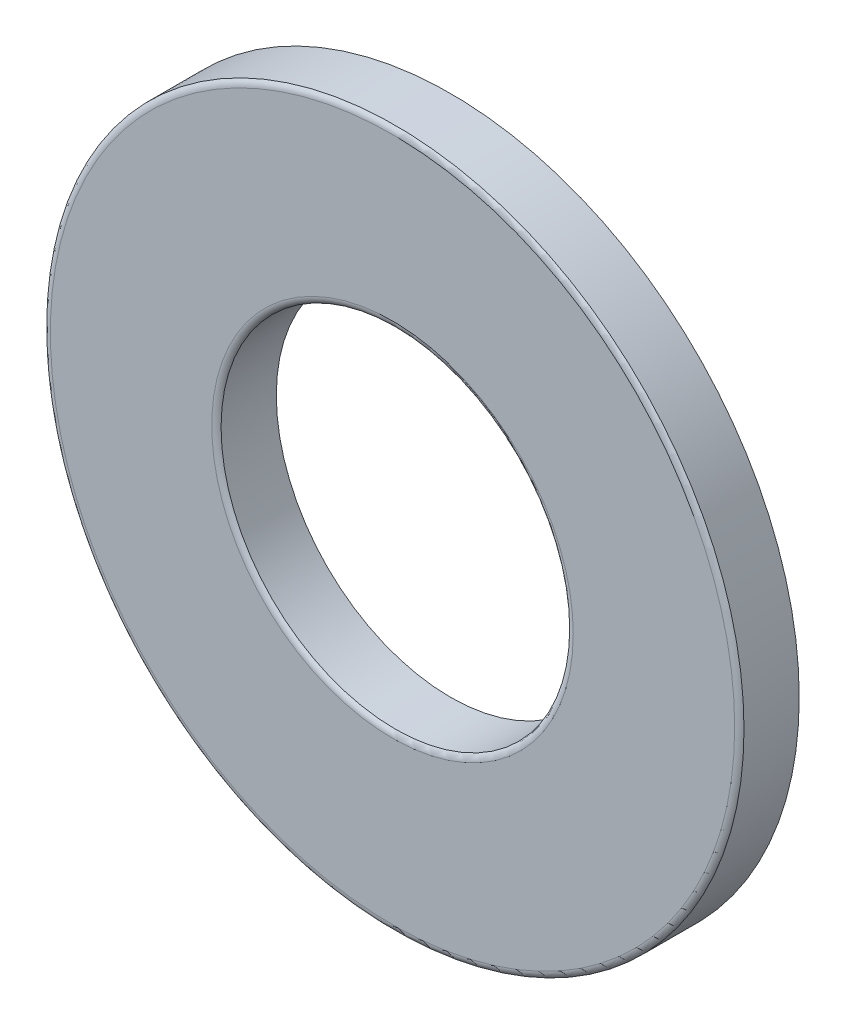
from build123d import *
from OCP.BRepFilletAPI import BRepFilletAPI_MakeChamfer

# Parameters (mm, degrees)
BOSS_EXTRUDE1_START = -0.7874
SKETCH3_R           = 19.05
SKETCH3_R_2         = 9.525
BOSS_EXTRUDE1_DEPTH = 3.175
CHAMFER1_SIZE       = 0.15748
CHAMFER1_SIZE2      = 0.09092112
FILLET1_R           = 0.47244


with BuildPart() as part:
    # Sketch3 → Boss-Extrude1 (new body)
    with BuildSketch(Plane.XY.offset(BOSS_EXTRUDE1_START)):
        Circle(SKETCH3_R)
        Circle(SKETCH3_R_2, mode=Mode.SUBTRACT)
    extrude(amount=BOSS_EXTRUDE1_DEPTH)

    # Chamfer1: one chamfer whose edges measure the first distance from different faces: ONE call of the kernel's chamfer builder (chamfer() names one face for all edges)
    chamfer1_edges_1 = [part.edges().sort_by_distance(p)[0] for p in [
        (-19.05, 0, 2.3876),
    ]]
    chamfer1_side_1 = [part.faces().sort_by_distance(p)[0] for p in [
        (-19.05, 0, 0.8001),
    ]]
    chamfer1_edges_2 = [part.edges().sort_by_distance(p)[0] for p in [
        (-9.525, 0, 2.3876),
    ]]
    chamfer1_side_2 = [part.faces().sort_by_distance(p)[0] for p in [
        (-9.525, 0, 0.8001),
    ]]
    chamfer1 = BRepFilletAPI_MakeChamfer(part.part.solid().wrapped)
    for e in chamfer1_edges_1:
        chamfer1.Add(CHAMFER1_SIZE, CHAMFER1_SIZE2, e.wrapped, chamfer1_side_1[0].wrapped)  # the first distance lies on this face
    for e in chamfer1_edges_2:
        chamfer1.Add(CHAMFER1_SIZE, CHAMFER1_SIZE2, e.wrapped, chamfer1_side_2[0].wrapped)  # the first distance lies on this face
    add(Compound.cast(chamfer1.Shape()), mode=Mode.REPLACE)

    # Fillet1
    # the kernel refuses this fillet: 0.47244 mm, written as the material it takes off along each edge
    with BuildSketch(Plane(origin=(0, 0, 2.3876), x_dir=(1, 0, 0), z_dir=(0, -1, 0))) as fillet1_piece_1:
        with BuildLine():
            CenterArc((18.697864015, -0.47244), FILLET1_R, 41.810314896, 48.189685104)
            Line((18.697864015, 0), (18.697864015, 0.0094488))
            Line((18.697864015, 0.0094488), (18.95907888, 0.0094488))
            Line((18.95907888, 0.0094488), (18.96726178, 0.0047244))
            ThreePointArc((18.96726178, 0.0047244), (19.012722341, -0.0740156), (19.05704272, -0.1511808))
            Line((19.05704272, -0.1511808), (19.05, -0.15748))
        make_face()
    revolve(axis=Axis((0, 0, 2.3876), (0, 0, 1)), mode=Mode.SUBTRACT)
    with BuildSketch(Plane(origin=(0, 0, 2.3876), x_dir=(1, 0, 0), z_dir=(0, -1, 0))) as fillet1_piece_2:
        with BuildLine():
            CenterArc((9.877135985, -0.47244), FILLET1_R, 90, 48.189685104)
            Line((9.525, -0.15748), (9.51795728, -0.1511808))
            ThreePointArc((9.51795728, -0.1511808), (9.562277659, -0.0740156), (9.60773822, 0.0047244))
            Line((9.60773822, 0.0047244), (9.61592112, 0.0094488))
            Line((9.61592112, 0.0094488), (9.877135985, 0.0094488))
            Line((9.877135985, 0.0094488), (9.877135985, 0))
        make_face()
    revolve(axis=Axis((0, 0, 2.3876), (0, 0, 1)), mode=Mode.SUBTRACT)


solid = part.part
